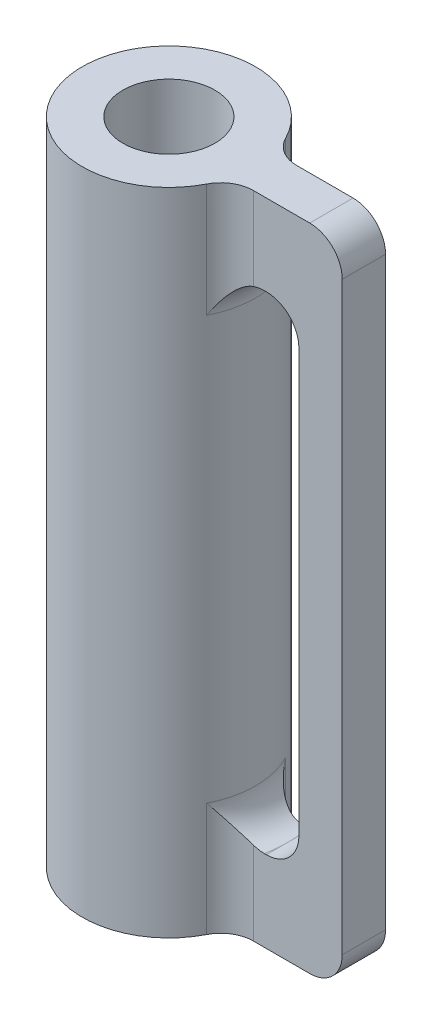
from build123d import *

# Parameters (mm, degrees)
SKETCH1_R           = 8
SKETCH1_R_2         = 4.25
BOSS_EXTRUDE1_DEPTH = 60
BOSS_EXTRUDE2_DEPTH = 2
FILLET1_R           = 3
SKETCH3_R           = 6.25
CUT_EXTRUDE1_DEPTH  = 30


with BuildPart() as part:
    # Sketch1 → Boss-Extrude1 (new body)
    with BuildSketch(Plane(origin=(0, 0, 0), x_dir=(1, 0, 0), z_dir=(0, 1, 0))):
        with Locations(Location((0, 0, 0), (0, 0, 270))):
            Circle(SKETCH1_R)
        with Locations(Location((0, 0, 0), (0, 0, 270))):
            Circle(SKETCH1_R_2, mode=Mode.SUBTRACT)
    extrude(amount=BOSS_EXTRUDE1_DEPTH)

    # Sketch2 → Boss-Extrude2 (add, symmetric)
    with BuildSketch(Plane.XY):
        Polygon((18, 60), (4.25, 60), (4.25, 52.5), (14, 52.5), (14, 7.5), (4.25, 7.5), (4.25, 0), (18, 0), align=None)
    extrude(amount=BOSS_EXTRUDE2_DEPTH, both=True)

    # Fillet1
    fillet1_edges = [part.edges().sort_by_distance(p)[0] for p in [
        (7.745966692, 3.75, -2),
        (7.745966692, 3.75, 2),
        (7.745966692, 56.25, -2),
        (7.745966692, 56.25, 2),
        (18, 0, 0),
        (18, 60, 0),
        (8, 52.5, 0),
        (14, 52.5, 0),
        (8, 7.5, 0),
        (14, 7.5, 0),
    ]]
    fillet(fillet1_edges, radius=FILLET1_R - 0.0001)  # a hair under: the kernel refuses the full size

    # Sketch3 → Cut-Extrude1 (cut)
    with BuildSketch(Plane.XZ):
        with Locations(Location((0, 0, 0), (0, 0, 270))):
            Circle(SKETCH3_R)
    extrude(amount=-CUT_EXTRUDE1_DEPTH, mode=Mode.SUBTRACT)


solid = part.part
